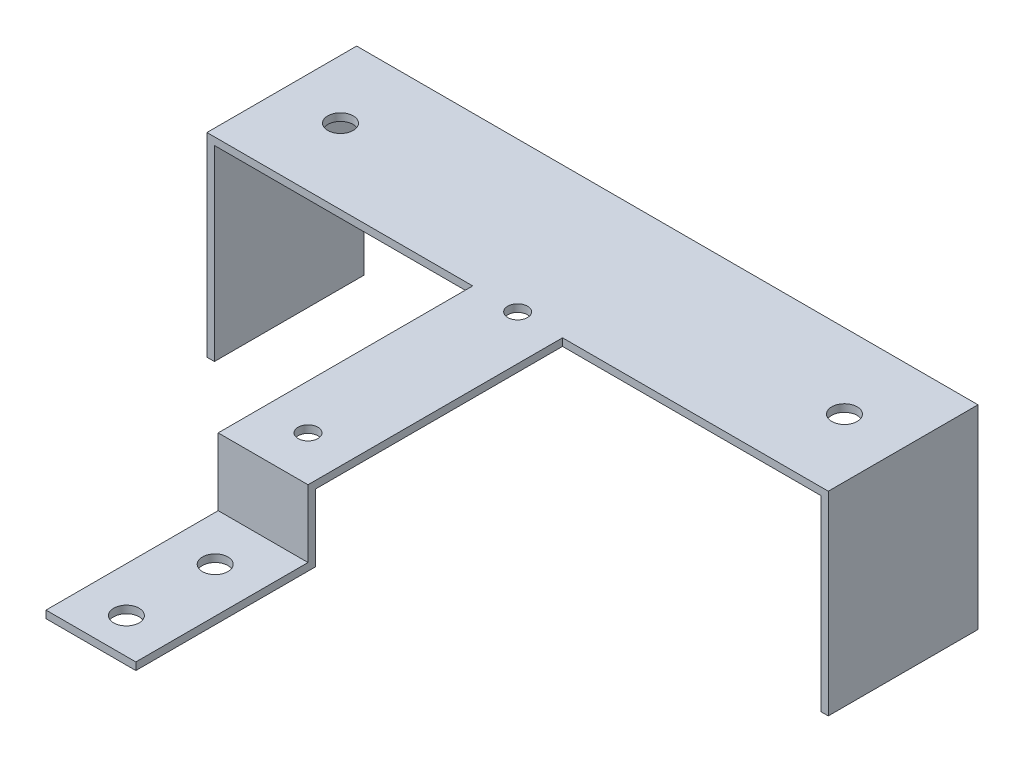
from build123d import *

# Parameters (mm, degrees)
BSSXTRD_CLIPTOPFACE_OUTLINE_R   = 1.6764
BSSXTRD_CLIPTOPFACE_OUTLINE_R_2 = 2.159
BSSXTRD_CLIPTOPFACE_DEPTH       = 1.27
SKTCH_CLIPSTANDOFFCROSSSEC_W    = 15.24
SKTCH_CLIPSTANDOFFCROSSSEC_H    = 1.27
BSSXTRD_CLIPLEG_DEPTH           = 11.43
SKTCH_CLIPFOOTCROSSSEC_W        = 15.24
SKTCH_CLIPFOOTCROSSSEC_H        = 1.27
BSSXTRD_CLIPFOOT_DEPTH          = 29.21
CTXTRD_CLIPFOOTHOLES_REACH      = 85.311
SKTCH_CLIPFOOTHOLES_R           = 2.159
SKTCH_CLIPSTANDOFFCROSSSEC_3_W  = 1.27
SKTCH_CLIPSTANDOFFCROSSSEC_3_H  = 25.4
BSSXTRD_CLIPTABS_DEPTH          = 31.75


# Read off the part's stored shape, not the designer's step: BssXtrd_ClipTopFace
with BuildPart() as part:
    # BssXtrd_ClipTopFace outline → BssXtrd_ClipTopFace (new body)
    with BuildSketch(Plane(origin=(0, 0, 0), x_dir=(1, 0, 0), z_dir=(0, 1, 0))):
        Polygon((-7.62, -34.29), (7.62, -34.29), (7.62, 8.89), (52.705, 8.89), (52.705, 34.29), (-52.705, 34.29), (-52.705, 8.89), (-7.62, 8.89), align=None)
        with Locations((0, -26.67)):
            Circle(BSSXTRD_CLIPTOPFACE_OUTLINE_R, mode=Mode.SUBTRACT)
        with Locations((-42.7482, 21.59)):
            Circle(BSSXTRD_CLIPTOPFACE_OUTLINE_R_2, mode=Mode.SUBTRACT)
        with Locations((0, 8.89)):
            Circle(BSSXTRD_CLIPTOPFACE_OUTLINE_R, mode=Mode.SUBTRACT)
        with Locations((42.7482, 21.59)):
            Circle(BSSXTRD_CLIPTOPFACE_OUTLINE_R_2, mode=Mode.SUBTRACT)
    extrude(amount=BSSXTRD_CLIPTOPFACE_DEPTH)

    # Sktch_ClipStandoffCrossSec → BssXtrd_ClipLeg (add)
    with BuildSketch(Plane.XZ):
        with Locations((0, 33.655)):
            Rectangle(SKTCH_CLIPSTANDOFFCROSSSEC_W, SKTCH_CLIPSTANDOFFCROSSSEC_H)
    extrude(amount=BSSXTRD_CLIPLEG_DEPTH)

    # Sktch_ClipFootCrossSec → BssXtrd_ClipFoot (add)
    with BuildSketch(Plane.XY.offset(34.29)):
        with Locations((0, -10.795)):
            Rectangle(SKTCH_CLIPFOOTCROSSSEC_W, SKTCH_CLIPFOOTCROSSSEC_H)
    extrude(amount=BSSXTRD_CLIPFOOT_DEPTH)

    # Sktch_ClipFootHoles → CtXtrd_ClipFootHoles (cut, up to next)
    with BuildSketch(Plane(origin=(0, -10.16, 0), x_dir=(1, 0, 0), z_dir=(0, 1, 0)), mode=Mode.PRIVATE) as ctxtrd_clipfootholes_sk1:
        with Locations(Location((0, -42.418, 0), (0, 0, 180))):
            Circle(SKTCH_CLIPFOOTHOLES_R)
    ctxtrd_clipfootholes_tool1 = extrude(ctxtrd_clipfootholes_sk1.sketch, amount=-CTXTRD_CLIPFOOTHOLES_REACH, mode=Mode.PRIVATE) & part.part
    # Sktch_ClipFootHoles → CtXtrd_ClipFootHoles (cut, up to next)
    with BuildSketch(Plane(origin=(0, -10.16, 0), x_dir=(1, 0, 0), z_dir=(0, 1, 0)), mode=Mode.PRIVATE) as ctxtrd_clipfootholes_sk2:
        with Locations(Location((0, -57.4802, 0), (0, 0, 180))):
            Circle(SKTCH_CLIPFOOTHOLES_R)
    ctxtrd_clipfootholes_tool2 = extrude(ctxtrd_clipfootholes_sk2.sketch, amount=-CTXTRD_CLIPFOOTHOLES_REACH, mode=Mode.PRIVATE) & part.part
    add(ctxtrd_clipfootholes_tool1.solids().sort_by_distance((0, -10.16, 42.418))[0], mode=Mode.SUBTRACT)
    add(ctxtrd_clipfootholes_tool2.solids().sort_by_distance((0, -10.16, 57.4802))[0], mode=Mode.SUBTRACT)

    # Sktch_ClipStandoffCrossSec<3> → BssXtrd_ClipTabs (add)
    with BuildSketch(Plane.XZ):
        with Locations((52.07, -21.59)):
            Rectangle(SKTCH_CLIPSTANDOFFCROSSSEC_3_W, SKTCH_CLIPSTANDOFFCROSSSEC_3_H)
        with Locations((-52.07, -21.59)):
            Rectangle(SKTCH_CLIPSTANDOFFCROSSSEC_3_W, SKTCH_CLIPSTANDOFFCROSSSEC_3_H)
    extrude(amount=BSSXTRD_CLIPTABS_DEPTH)


solid = part.part
